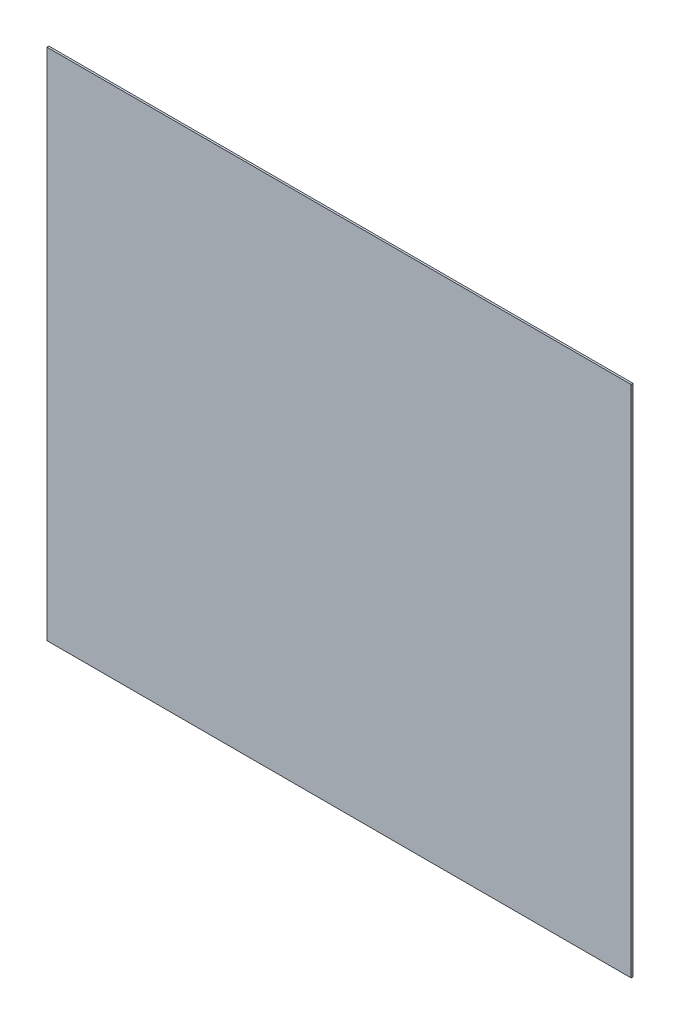
from build123d import *

# Parameters (mm, degrees)
SKETCH1_W           = 762
SKETCH1_H           = 670.269013028
BOSS_EXTRUDE1_DEPTH = 2.54


with BuildPart() as part:
    # Sketch1 → Boss-Extrude1 (new body)
    with BuildSketch(Plane.XY):
        with Locations((381, 335.134506514)):
            Rectangle(SKETCH1_W, SKETCH1_H)
    extrude(amount=BOSS_EXTRUDE1_DEPTH)


solid = part.part
